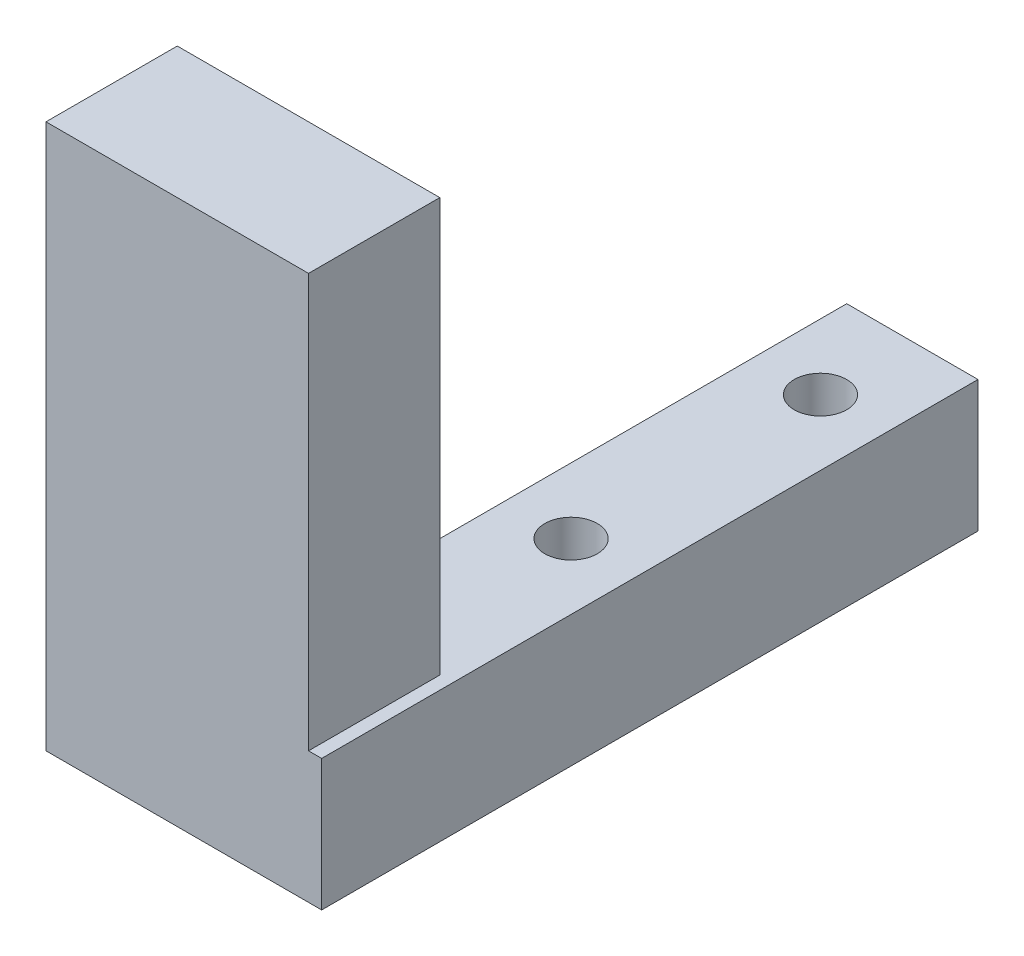
from build123d import *

# Parameters (mm, degrees)
SKETCH1_W           = 10
SKETCH1_H           = 10
BOSS_EXTRUDE1_DEPTH = 50
SKETCH3_W           = 10
SKETCH3_H           = 10
BOSS_EXTRUDE3_DEPTH = 11
SKETCH8_W           = 20
SKETCH8_H           = 10
BOSS_EXTRUDE4_DEPTH = 23
SKETCH9_R           = 2
CUT_EXTRUDE2_DEPTH  = 23
SKETCH9_4_R         = 2
CUT_EXTRUDE3_DEPTH  = 23
SKETCH8_4_W         = 20
SKETCH8_4_H         = 10
BOSS_EXTRUDE5_DEPTH = 31
SKETCH8_5_W         = 20
SKETCH8_5_H         = 10
BOSS_EXTRUDE6_DEPTH = 31.5


with BuildPart() as part:
    # Sketch1 → Boss-Extrude1 (new body)
    with BuildSketch(Plane.XY):
        with Locations((-2.851282988, -1.356707317)):
            Rectangle(SKETCH1_W, SKETCH1_H)
    extrude(amount=BOSS_EXTRUDE1_DEPTH)

    # Sketch3 → Boss-Extrude3 (add)
    with BuildSketch(Plane.ZY.offset(7.851282988)):
        with Locations((45, -1.356707317)):
            Rectangle(SKETCH3_W, SKETCH3_H)
    extrude(amount=BOSS_EXTRUDE3_DEPTH)

    # Sketch8 → Boss-Extrude4 (add)
    with BuildSketch(Plane(origin=(0, 3.643292683, 0), x_dir=(1, 0, 0), z_dir=(0, 1, 0))):
        with Locations((-8.851282988, -45)):
            Rectangle(SKETCH8_W, SKETCH8_H)
    extrude(amount=BOSS_EXTRUDE4_DEPTH)

    # Sketch9 → Cut-Extrude2 (cut)
    with BuildSketch(Plane(origin=(0, 3.643292683, 0), x_dir=(1, 0, 0), z_dir=(0, 1, 0))):
        with Locations((-2.851282988, -7)):
            Circle(SKETCH9_R)
    extrude(amount=-CUT_EXTRUDE2_DEPTH, mode=Mode.SUBTRACT)

    # Sketch9<4> → Cut-Extrude3 (cut)
    with BuildSketch(Plane(origin=(0, 3.643292683, 0), x_dir=(1, 0, 0), z_dir=(0, 1, 0))):
        with Locations((-2.851282988, -26)):
            Circle(SKETCH9_4_R)
    extrude(amount=-CUT_EXTRUDE3_DEPTH, mode=Mode.SUBTRACT)

    # Sketch8<4> → Boss-Extrude5 (add)
    with BuildSketch(Plane(origin=(0, 3.643292683, 0), x_dir=(1, 0, 0), z_dir=(0, 1, 0))):
        with Locations((-8.851282988, -45)):
            Rectangle(SKETCH8_4_W, SKETCH8_4_H)
    extrude(amount=BOSS_EXTRUDE5_DEPTH)

    # Sketch8<5> → Boss-Extrude6 (add)
    with BuildSketch(Plane(origin=(0, 3.643292683, 0), x_dir=(1, 0, 0), z_dir=(0, 1, 0))):
        with Locations((-8.851282988, -45)):
            Rectangle(SKETCH8_5_W, SKETCH8_5_H)
    extrude(amount=BOSS_EXTRUDE6_DEPTH)


solid = part.part
